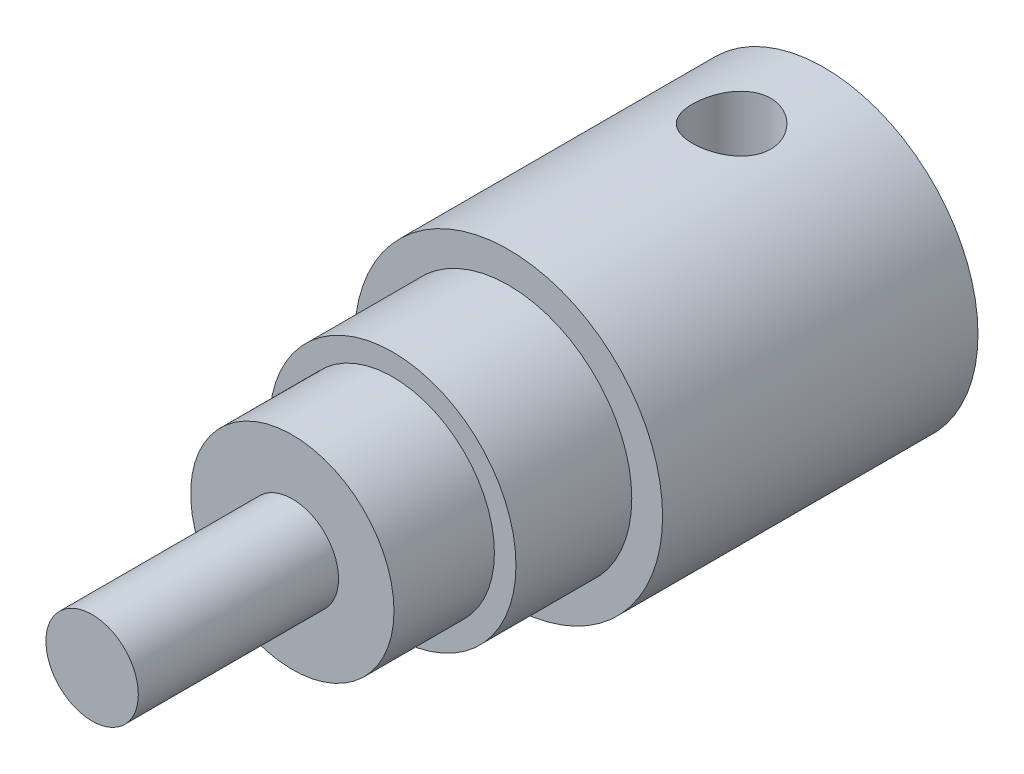
from build123d import *

# Parameters (mm, degrees)
ESQUISSE1_R                  = 25
BOSS_EXTRU_1_DEPTH           = 51.2
ESQUISSE2_R                  = 20
BOSS_EXTRU_2_DEPTH           = 18.8
ESQUISSE3_R                  = 16.5
BOSS_EXTRU_3_DEPTH           = 16.7
ESQUISSE4_R                  = 27.5
BOSS_EXTRU_4_DEPTH           = 47.1
CHANFREIN1_SIZE              = 10
CHANFREIN1_SIZE2             = 17.320508076
ENL_V_MAT_EXTRU_1_DEPTH      = 140.337503925
ENL_V_MAT_EXTRU_1_DEPTH_BACK = 140.337503925
ESQUISSE12_R                 = 6.35
ESQUISSE13_R                 = 47.258439022
ENL_V_MAT_EXTRU_2_DEPTH      = 15
ESQUISSE14_R                 = 39.934727028
ESQUISSE14_R_2               = 7.5
ENL_V_MAT_EXTRU_4_DEPTH      = 32.5


with BuildPart() as part:
    # Esquisse1 → Boss.-Extru.1 (new body)
    with BuildSketch(Plane.XY):
        Circle(ESQUISSE1_R)
    extrude(amount=BOSS_EXTRU_1_DEPTH)

    # Esquisse2 → Boss.-Extru.2 (add)
    with BuildSketch(Plane.XY.offset(51.2)):
        Circle(ESQUISSE2_R)
    extrude(amount=BOSS_EXTRU_2_DEPTH)

    # Esquisse3 → Boss.-Extru.3 (add)
    with BuildSketch(Plane.XY.offset(70)):
        Circle(ESQUISSE3_R)
    extrude(amount=BOSS_EXTRU_3_DEPTH)

    # Esquisse4 → Boss.-Extru.4 (add)
    with BuildSketch(Plane.XY.offset(86.7)):
        Circle(ESQUISSE4_R)
    extrude(amount=BOSS_EXTRU_4_DEPTH)

    # Chanfrein1
    chanfrein1_edges = [part.edges().sort_by_distance(p)[0] for p in [
        (-27.5, 0, 86.7),
    ]]
    chanfrein1_side = [part.faces().sort_by_distance(p)[0] for p in [
        (-26.722182541, 0, 86.7),
    ]]
    chamfer(chanfrein1_edges, length=CHANFREIN1_SIZE, length2=CHANFREIN1_SIZE2, reference=chanfrein1_side[0])

    # Esquisse12 → Enlèv. mat.-Extru.1 (cut, two sides: drawn at the far end of the back side and taken through both)
    with BuildSketch(Plane(origin=(0, 0, 0), x_dir=(1, 0, 0), z_dir=(0, 1, 0)).offset(-ENL_V_MAT_EXTRU_1_DEPTH_BACK)):
        with Locations((0, -15)):
            Circle(ESQUISSE12_R)
    extrude(amount=ENL_V_MAT_EXTRU_1_DEPTH + ENL_V_MAT_EXTRU_1_DEPTH_BACK, mode=Mode.SUBTRACT)

    # Esquisse13 → Enlèv. mat.-Extru.2 (cut)
    with BuildSketch(Plane.XY.offset(133.8)):
        with Locations((0.544033406, 0)):
            Circle(ESQUISSE13_R)
    extrude(amount=-ENL_V_MAT_EXTRU_2_DEPTH, mode=Mode.SUBTRACT)

    # Esquisse14 → Enlèv. mat.-Extru.4 (cut)
    with BuildSketch(Plane.XY.offset(118.8)):
        Circle(ESQUISSE14_R)
        Circle(ESQUISSE14_R_2, mode=Mode.SUBTRACT)
    extrude(amount=-ENL_V_MAT_EXTRU_4_DEPTH, mode=Mode.SUBTRACT)


solid = part.part
